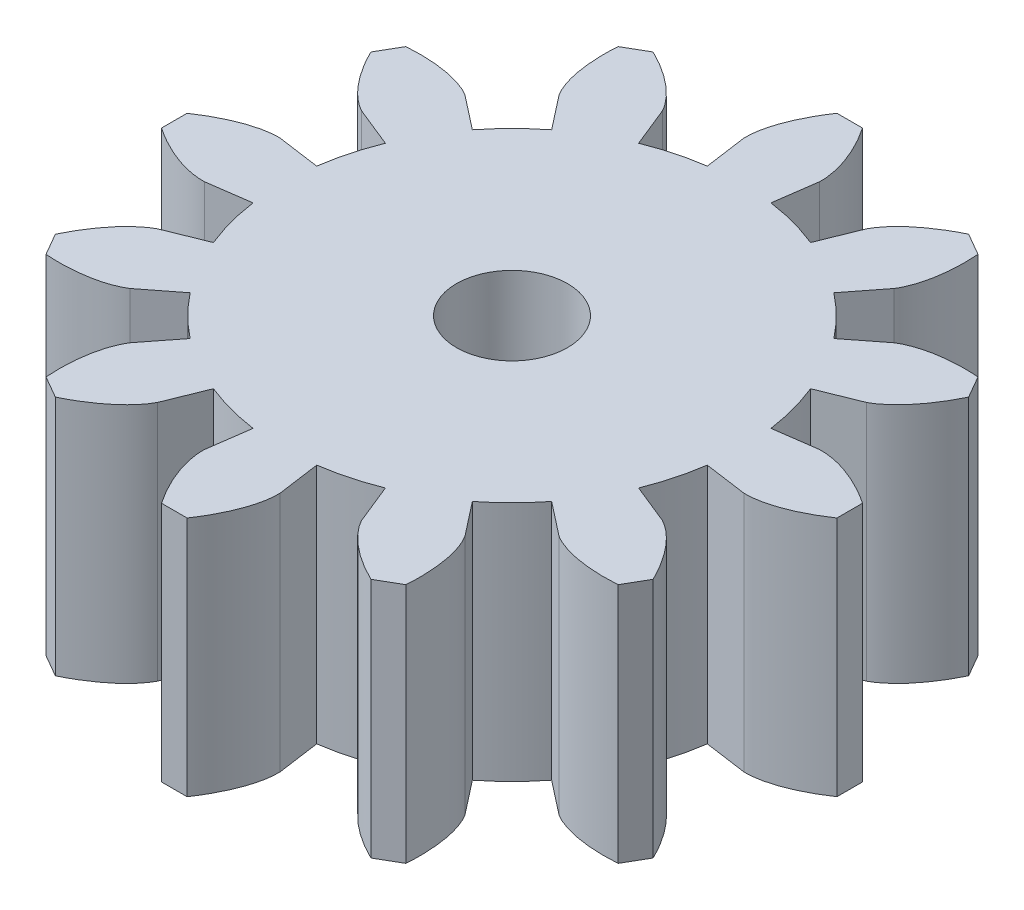
from build123d import *

# Parameters (mm, degrees)
BOSS_EXTRUDE1_DEPTH     = 5
CUT_EXTRUDE1_DEPTH      = 12.084223379
CUT_EXTRUDE1_DEPTH_BACK = 12.084223379
SKETCH2_R               = 1.15


with BuildPart() as part:
    # Sketch1 → Boss-Extrude1 (new body)
    with BuildSketch(Plane.XZ.offset(5)):
        with BuildLine():
            Line((3.744124802, -2.923017186), (4.444201828, -3.469563385))
            add(Edge.make_bspline(
                [(4.444201828, -3.469563385), (4.960450288, -3.799470899), (5.92556066, -3.726624593)],
                knots=[3.673021655, 3.673021655, 3.673021655, 4.715634663, 4.715634663, 4.715634663], degree=2, weights=[1, 0.867169263, 1]))
            Line((5.92556066, -3.726624593), (6.190131898, -3.268373767))
            add(Edge.make_bspline(
                [(6.190131898, -3.268373767), (5.77062665, -2.395142555), (5.226830946, -2.11400999)],
                knots=[1.547057367, 1.547057367, 1.547057367, 2.608226651, 2.608226651, 2.608226651], degree=2, weights=[1, 0.862511367, 1]))
            Line((5.226830946, -2.11400999), (4.40346954, -1.7809986))
            ThreePointArc((4.40346954, -1.7809986), (4.588147675, -1.229390464), (4.704015786, -0.659344738))
            Line((4.704015786, -0.659344738), (5.583573376, -0.782629118))
            add(Edge.make_bspline(
                [(5.583573376, -0.782629118), (6.195611413, -0.810213176), (6.99499836, -0.264571238)],
                knots=[3.673021655, 3.673021655, 3.673021655, 4.715634663, 4.715634663, 4.715634663], degree=2, weights=[1, 0.867169263, 1]))
            Line((6.99499836, -0.264571238), (6.99499836, 0.264571238))
            add(Edge.make_bspline(
                [(6.99499836, 0.264571238), (6.195080552, 0.811059027), (5.583573376, 0.782629118)],
                knots=[1.547057367, 1.547057367, 1.547057367, 2.608226651, 2.608226651, 2.608226651], degree=2, weights=[1, 0.862511367, 1]))
            Line((5.583573376, 0.782629118), (4.704015786, 0.659344738))
            ThreePointArc((4.704015786, 0.659344738), (4.588147675, 1.229390464), (4.40346954, 1.7809986))
            Line((4.40346954, 1.7809986), (5.226830946, 2.11400999))
            add(Edge.make_bspline(
                [(5.226830946, 2.11400999), (5.770663464, 2.396140514), (6.190131898, 3.268373767)],
                knots=[0.531429001, 0.531429001, 0.531429001, 1.57404201, 1.57404201, 1.57404201], degree=2, weights=[1, 0.867169263, 1]))
            Line((6.190131898, 3.268373767), (5.92556066, 3.726624593))
            add(Edge.make_bspline(
                [(5.92556066, 3.726624593), (4.959567623, 3.799937997), (4.444201828, 3.469563385)],
                knots=[1.547057367, 1.547057367, 1.547057367, 2.608226651, 2.608226651, 2.608226651], degree=2, weights=[1, 0.862511367, 1]))
            Line((4.444201828, 3.469563385), (3.744124802, 2.923017186))
            ThreePointArc((3.744124802, 2.923017186), (3.358757211, 3.358757211), (2.923017186, 3.744124802))
            Line((2.923017186, 3.744124802), (3.469563385, 4.444201828))
            add(Edge.make_bspline(
                [(3.469563385, 4.444201828), (3.799470899, 4.960450288), (3.726624593, 5.92556066)],
                knots=[0.531429001, 0.531429001, 0.531429001, 1.57404201, 1.57404201, 1.57404201], degree=2, weights=[1, 0.867169263, 1]))
            Line((3.726624593, 5.92556066), (3.268373767, 6.190131898))
            add(Edge.make_bspline(
                [(3.268373767, 6.190131898), (2.395142555, 5.77062665), (2.11400999, 5.226830946)],
                knots=[1.547057367, 1.547057367, 1.547057367, 2.608226651, 2.608226651, 2.608226651], degree=2, weights=[1, 0.862511367, 1]))
            Line((2.11400999, 5.226830946), (1.7809986, 4.40346954))
            ThreePointArc((1.7809986, 4.40346954), (1.229390464, 4.588147675), (0.659344738, 4.704015786))
            Line((0.659344738, 4.704015786), (0.782629118, 5.583573376))
            add(Edge.make_bspline(
                [(0.782629118, 5.583573376), (0.810213176, 6.195611413), (0.264571238, 6.99499836)],
                knots=[0.531429001, 0.531429001, 0.531429001, 1.57404201, 1.57404201, 1.57404201], degree=2, weights=[1, 0.867169263, 1]))
            Line((0.264571238, 6.99499836), (-0.264571238, 6.99499836))
            add(Edge.make_bspline(
                [(-0.264571238, 6.99499836), (-0.811059027, 6.195080552), (-0.782629118, 5.583573376)],
                knots=[4.688650021, 4.688650021, 4.688650021, 5.749819305, 5.749819305, 5.749819305], degree=2, weights=[1, 0.862511367, 1]))
            Line((-0.782629118, 5.583573376), (-0.659344738, 4.704015786))
            ThreePointArc((-0.659344738, 4.704015786), (-1.229390464, 4.588147675), (-1.7809986, 4.40346954))
            Line((-1.7809986, 4.40346954), (-2.11400999, 5.226830946))
            add(Edge.make_bspline(
                [(-2.11400999, 5.226830946), (-2.396140514, 5.770663464), (-3.268373767, 6.190131898)],
                knots=[0.531429001, 0.531429001, 0.531429001, 1.57404201, 1.57404201, 1.57404201], degree=2, weights=[1, 0.867169263, 1]))
            Line((-3.268373767, 6.190131898), (-3.726624593, 5.92556066))
            add(Edge.make_bspline(
                [(-3.726624593, 5.92556066), (-3.799937997, 4.959567623), (-3.469563385, 4.444201828)],
                knots=[4.688650021, 4.688650021, 4.688650021, 5.749819305, 5.749819305, 5.749819305], degree=2, weights=[1, 0.862511367, 1]))
            Line((-3.469563385, 4.444201828), (-2.923017186, 3.744124802))
            ThreePointArc((-2.923017186, 3.744124802), (-3.358757211, 3.358757211), (-3.744124802, 2.923017186))
            Line((-3.744124802, 2.923017186), (-4.444201828, 3.469563385))
            add(Edge.make_bspline(
                [(-4.444201828, 3.469563385), (-4.960450288, 3.799470899), (-5.92556066, 3.726624593)],
                knots=[0.531429001, 0.531429001, 0.531429001, 1.57404201, 1.57404201, 1.57404201], degree=2, weights=[1, 0.867169263, 1]))
            Line((-5.92556066, 3.726624593), (-6.190131898, 3.268373767))
            add(Edge.make_bspline(
                [(-6.190131898, 3.268373767), (-5.77062665, 2.395142555), (-5.226830946, 2.11400999)],
                knots=[4.688650021, 4.688650021, 4.688650021, 5.749819305, 5.749819305, 5.749819305], degree=2, weights=[1, 0.862511367, 1]))
            Line((-5.226830946, 2.11400999), (-4.40346954, 1.7809986))
            ThreePointArc((-4.40346954, 1.7809986), (-4.588147675, 1.229390464), (-4.704015786, 0.659344738))
            Line((-4.704015786, 0.659344738), (-5.583573376, 0.782629118))
            add(Edge.make_bspline(
                [(-5.583573376, 0.782629118), (-6.195611413, 0.810213176), (-6.99499836, 0.264571238)],
                knots=[0.531429001, 0.531429001, 0.531429001, 1.57404201, 1.57404201, 1.57404201], degree=2, weights=[1, 0.867169263, 1]))
            Line((-6.99499836, 0.264571238), (-6.99499836, -0.264571238))
            add(Edge.make_bspline(
                [(-6.99499836, -0.264571238), (-6.195080552, -0.811059027), (-5.583573376, -0.782629118)],
                knots=[4.688650021, 4.688650021, 4.688650021, 5.749819305, 5.749819305, 5.749819305], degree=2, weights=[1, 0.862511367, 1]))
            Line((-5.583573376, -0.782629118), (-4.704015786, -0.659344738))
            ThreePointArc((-4.704015786, -0.659344738), (-4.588147675, -1.229390464), (-4.40346954, -1.7809986))
            Line((-4.40346954, -1.7809986), (-5.226830946, -2.11400999))
            add(Edge.make_bspline(
                [(-5.226830946, -2.11400999), (-5.770663464, -2.396140514), (-6.190131898, -3.268373767)],
                knots=[3.673021655, 3.673021655, 3.673021655, 4.715634663, 4.715634663, 4.715634663], degree=2, weights=[1, 0.867169263, 1]))
            Line((-6.190131898, -3.268373767), (-5.92556066, -3.726624593))
            add(Edge.make_bspline(
                [(-5.92556066, -3.726624593), (-4.959567623, -3.799937997), (-4.444201828, -3.469563385)],
                knots=[4.688650021, 4.688650021, 4.688650021, 5.749819305, 5.749819305, 5.749819305], degree=2, weights=[1, 0.862511367, 1]))
            Line((-4.444201828, -3.469563385), (-3.744124802, -2.923017186))
            ThreePointArc((-3.744124802, -2.923017186), (-3.358757211, -3.358757211), (-2.923017186, -3.744124802))
            Line((-2.923017186, -3.744124802), (-3.469563385, -4.444201828))
            add(Edge.make_bspline(
                [(-3.469563385, -4.444201828), (-3.799470899, -4.960450288), (-3.726624593, -5.92556066)],
                knots=[3.673021655, 3.673021655, 3.673021655, 4.715634663, 4.715634663, 4.715634663], degree=2, weights=[1, 0.867169263, 1]))
            Line((-3.726624593, -5.92556066), (-3.268373767, -6.190131898))
            add(Edge.make_bspline(
                [(-3.268373767, -6.190131898), (-2.395142555, -5.77062665), (-2.11400999, -5.226830946)],
                knots=[1.547057367, 1.547057367, 1.547057367, 2.608226651, 2.608226651, 2.608226651], degree=2, weights=[1, 0.862511367, 1]))
            Line((-2.11400999, -5.226830946), (-1.7809986, -4.40346954))
            ThreePointArc((-1.7809986, -4.40346954), (-1.229390464, -4.588147675), (-0.659344738, -4.704015786))
            Line((-0.659344738, -4.704015786), (-0.782629118, -5.583573376))
            add(Edge.make_bspline(
                [(-0.782629118, -5.583573376), (-0.810213176, -6.195611413), (-0.264571238, -6.99499836)],
                knots=[3.673021655, 3.673021655, 3.673021655, 4.715634663, 4.715634663, 4.715634663], degree=2, weights=[1, 0.867169263, 1]))
            Line((-0.264571238, -6.99499836), (0.264571238, -6.99499836))
            add(Edge.make_bspline(
                [(0.264571238, -6.99499836), (0.811059027, -6.195080552), (0.782629118, -5.583573376)],
                knots=[1.547057367, 1.547057367, 1.547057367, 2.608226651, 2.608226651, 2.608226651], degree=2, weights=[1, 0.862511367, 1]))
            Line((0.782629118, -5.583573376), (0.659344738, -4.704015786))
            ThreePointArc((0.659344738, -4.704015786), (1.229390464, -4.588147675), (1.7809986, -4.40346954))
            Line((1.7809986, -4.40346954), (2.11400999, -5.226830946))
            add(Edge.make_bspline(
                [(2.11400999, -5.226830946), (2.396140514, -5.770663464), (3.268373767, -6.190131898)],
                knots=[3.673021655, 3.673021655, 3.673021655, 4.715634663, 4.715634663, 4.715634663], degree=2, weights=[1, 0.867169263, 1]))
            Line((3.268373767, -6.190131898), (3.726624593, -5.92556066))
            add(Edge.make_bspline(
                [(3.726624593, -5.92556066), (3.799937997, -4.959567623), (3.469563385, -4.444201828)],
                knots=[1.547057367, 1.547057367, 1.547057367, 2.608226651, 2.608226651, 2.608226651], degree=2, weights=[1, 0.862511367, 1]))
            Line((3.469563385, -4.444201828), (2.923017186, -3.744124802))
            ThreePointArc((2.923017186, -3.744124802), (3.358757211, -3.358757211), (3.744124802, -2.923017186))
        make_face()
    extrude(amount=-BOSS_EXTRUDE1_DEPTH)

    # Sketch2 → Cut-Extrude1 (cut, two sides: drawn at the far end of the back side and taken through both)
    with BuildSketch(Plane(origin=(0, 0, 0), x_dir=(1, 0, 0), z_dir=(0, 1, 0)).offset(-CUT_EXTRUDE1_DEPTH_BACK)):
        Circle(SKETCH2_R)
    extrude(amount=CUT_EXTRUDE1_DEPTH + CUT_EXTRUDE1_DEPTH_BACK, mode=Mode.SUBTRACT)


solid = part.part
